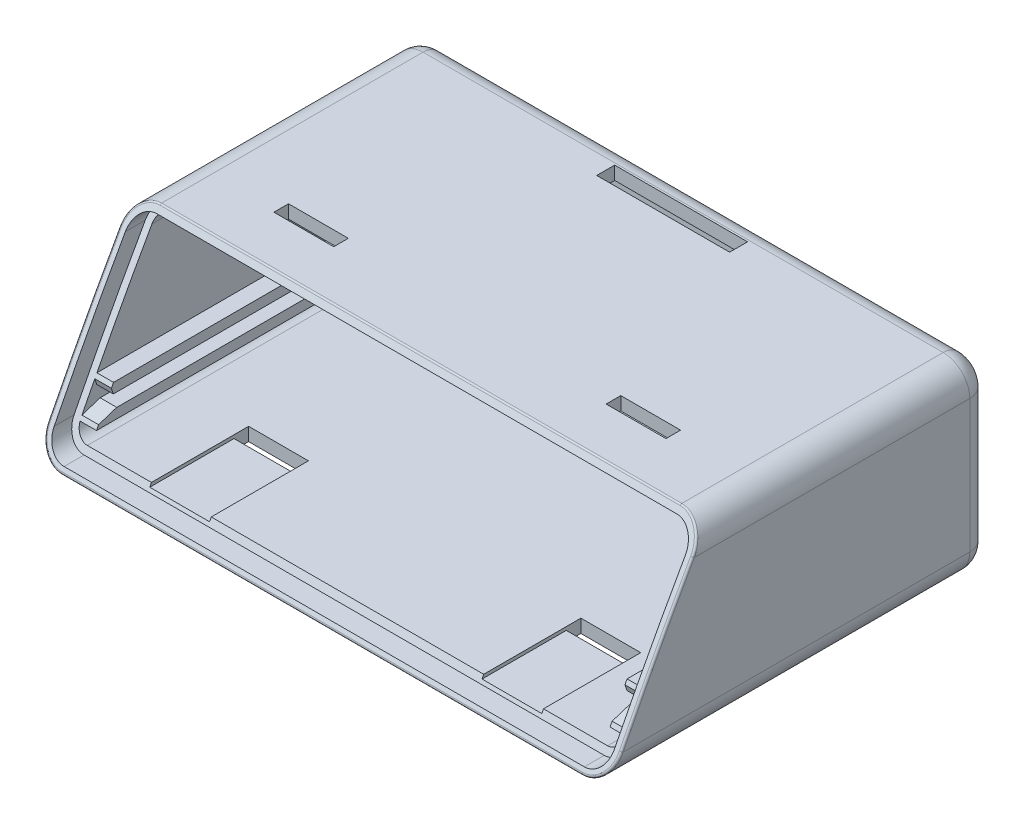
from build123d import *

# Parameters (mm, degrees)
SKETCH1_W                = 86.28
SKETCH1_H                = 57.5
BOSS_EXTRUDE1_DEPTH      = 28
FILLET1_R                = 4
SHELL1_T                 = -2
CUT_EXTRUDE1_DEPTH       = 96.156717577
SKETCH3_W                = 14.3
SKETCH3_H                = 16.7
SKETCH3_W_2              = 11.05
SKETCH3_H_2              = 14.049996967
CUT_EXTRUDE2_DEPTH       = 2
FILLET2_R                = 3
CUT_EXTRUDE3_REACH       = 157.666
CUT_EXTRUDE3_END_RADIUS  = 475
CUT_EXTRUDE3_START       = 80
FILLET3_R                = 0.3
BOSS_EXTRUDE2_REACH      = 77.532
BOSS_EXTRUDE2_END_RADIUS = 475
SKETCH5_W                = 2.5
SKETCH5_H                = 1.5
SKETCH6_W                = 9
SKETCH6_H                = 2.2
CUT_EXTRUDE4_DEPTH       = 2
SKETCH9_W                = 9
SKETCH9_H                = 2.2
CUT_EXTRUDE7_DEPTH       = 2
SKETCH7_W                = 20
SKETCH7_H                = 2.4
CUT_EXTRUDE5_DEPTH       = 2
SKETCH8_W                = 9
SKETCH8_H                = 0.5
CUT_EXTRUDE6_DEPTH       = 63.254847315
SKETCH10_W               = 9
SKETCH10_H               = 0.5
CUT_EXTRUDE8_DEPTH       = 66.822686167
SKETCH11_W               = 2.84
SKETCH11_H               = 2
SKETCH11_W_2             = 33.99
SKETCH11_W_3             = 20.1
BOSS_EXTRUDE3_DEPTH      = 0.5
CHAMFER1_SIZE2           = 2.284662113
CHAMFER1_SIZE            = 1
CHAMFER1_EDGE_2_SIZE2    = 0.742484525
CHAMFER1_EDGE_2_SIZE     = 1
CHAMFER1_EDGE_3_SIZE2    = 0.742484525
CHAMFER1_EDGE_3_SIZE     = 1
CHAMFER1_EDGE_4_SIZE2    = 2.284662113
CHAMFER1_EDGE_4_SIZE     = 1
SKETCH12_W               = 20
SKETCH12_H               = 2
CUT_EXTRUDE9_DEPTH       = 0.3


with BuildPart() as part:
    # Sketch1 → Boss-Extrude1 (new body)
    with BuildSketch(Plane(origin=(0, 0, 0), x_dir=(1, 0, 0), z_dir=(0, 1, 0))):
        Rectangle(SKETCH1_W, SKETCH1_H)
    extrude(amount=BOSS_EXTRUDE1_DEPTH)

    # Fillet1
    fillet1_edges = [part.edges().sort_by_distance(p)[0] for p in [
        (-43.14, 28, 0),
        (43.14, 28, 0),
        (-43.14, 0, 0),
        (43.14, 0, 0),
    ]]
    fillet(fillet1_edges, radius=FILLET1_R)

    # Shell1
    shell1_openings = [part.faces().sort_by_distance(p)[0] for p in [
        (0, 14, 28.75),
    ]]
    offset(amount=SHELL1_T, openings=shell1_openings, kind=Kind.INTERSECTION)

    # Sketch2 → Cut-Extrude1 (cut, through all)
    with BuildSketch(Plane.ZY.offset(43.14)):
        with BuildLine():
            Line((13.75, 28), (28.75, 28))
            Line((28.75, 28), (28.75, 0))
            ThreePointArc((28.75, 0), (21.484121584, 14.125422277), (13.75, 28))
        make_face()
    extrude(amount=-CUT_EXTRUDE1_DEPTH, mode=Mode.SUBTRACT)

    # Sketch3 → Cut-Extrude2 (cut)
    with BuildSketch(Plane(origin=(0, 0, -28.75), x_dir=(-1, 0, 0), z_dir=(0, 0, -1))):
        with Locations((0, 10.35)):
            Rectangle(SKETCH3_W, SKETCH3_H)
        with Locations((32.775, 10.175001517)):
            Rectangle(SKETCH3_W_2, SKETCH3_H_2)
    extrude(amount=-CUT_EXTRUDE2_DEPTH, mode=Mode.SUBTRACT)

    # Fillet2
    # the kernel refuses this fillet: 3 mm, written as the material it takes off along each edge
    with BuildSketch(Plane(origin=(39.14, 24, -28.75), x_dir=(1, 0, 0), z_dir=(0, -1, 0))) as fillet2_piece_1:
        with BuildLine():
            CenterArc((4 - FILLET2_R, FILLET2_R), FILLET2_R, 270, 90)
            Line((4, FILLET2_R), (4, 0))
            Line((4, 0), (4 - FILLET2_R, 0))
        make_face()
    revolve(axis=Axis((39.14, 24, -28.75), (0, 0, 1)), revolution_arc=90, mode=Mode.SUBTRACT)
    with BuildSketch(Plane(origin=(43.14, 4, -28.75), x_dir=(-1, 0, 0), z_dir=(0, 1, 0)), Plane(origin=(-43.14, 4, -28.75), x_dir=(0, 0, 1), z_dir=(0, 1, 0))) as fillet2_piece_2:
        with BuildLine():
            CenterArc((FILLET2_R, FILLET2_R), FILLET2_R, 180, 90)
            Line((0, FILLET2_R), (0, 0))
            Line((0, 0), (FILLET2_R, 0))
        make_face()
    extrude(amount=20, mode=Mode.SUBTRACT)
    with BuildSketch(Plane(origin=(39.14, 4, -28.75), x_dir=(1, 0, 0), z_dir=(0, 1, 0))) as fillet2_piece_3:
        with BuildLine():
            CenterArc((4 - FILLET2_R, -FILLET2_R), FILLET2_R, 0, 90)
            Line((4, -FILLET2_R), (4, 0))
            Line((4, 0), (4 - FILLET2_R, 0))
        make_face()
    revolve(axis=Axis((39.14, 4, -28.75), (0, 0, -1)), revolution_arc=90, mode=Mode.SUBTRACT)
    with BuildSketch(Plane(origin=(39.14, 0, -28.75), x_dir=(0, 1, 0), z_dir=(-1, 0, 0))) as fillet2_piece_4:
        with BuildLine():
            CenterArc((FILLET2_R, -FILLET2_R), FILLET2_R, 90, 90)
            Line((0, -FILLET2_R), (0, 0))
            Line((0, 0), (FILLET2_R, 0))
        make_face()
    extrude(amount=78.28, mode=Mode.SUBTRACT)
    with BuildSketch(Plane(origin=(-39.14, 4, -28.75), x_dir=(-1, 0, 0), z_dir=(0, 1, 0))) as fillet2_piece_5:
        with BuildLine():
            CenterArc((4 - FILLET2_R, FILLET2_R), FILLET2_R, 270, 90)
            Line((4 - FILLET2_R, 0), (4, 0))
            Line((4, 0), (4, FILLET2_R))
        make_face()
    revolve(axis=Axis((-39.14, 4, -28.75), (0, 0, 1)), revolution_arc=90, mode=Mode.SUBTRACT)
    with BuildSketch(Plane(origin=(-39.14, 24, -28.75), x_dir=(-1, 0, 0), z_dir=(0, -1, 0))) as fillet2_piece_6:
        with BuildLine():
            CenterArc((4 - FILLET2_R, -FILLET2_R), FILLET2_R, 0, 90)
            Line((4 - FILLET2_R, 0), (4, 0))
            Line((4, 0), (4, -FILLET2_R))
        make_face()
    revolve(axis=Axis((-39.14, 24, -28.75), (0, 0, -1)), revolution_arc=90, mode=Mode.SUBTRACT)
    with BuildSketch(Plane(origin=(39.14, 28, -28.75), x_dir=(0, -1, 0), z_dir=(-1, 0, 0))) as fillet2_piece_7:
        with BuildLine():
            CenterArc((FILLET2_R, FILLET2_R), FILLET2_R, 180, 90)
            Line((0, FILLET2_R), (0, 0))
            Line((0, 0), (FILLET2_R, 0))
        make_face()
    extrude(amount=78.28, mode=Mode.SUBTRACT)

    # Cut-Extrude3: up to this cylinder (the profile starts outside it)
    cut_extrude3_end = Plane(origin=(-23.145, -210.179748667, -400.218864179), z_dir=(-1, 0, 0)) * Cylinder(CUT_EXTRUDE3_END_RADIUS, 1266.332, mode=Mode.PRIVATE)
    # Sketch4 → Cut-Extrude3 (cut, up to the surface)
    with BuildSketch(Plane.XY.offset(-26.75).offset(CUT_EXTRUDE3_START), mode=Mode.PRIVATE) as cut_extrude3_sk1:
        with BuildLine():
            Line((-7.15, 1), (7.15, 1))
            Line((7.15, 1), (39.14, 1))
            ThreePointArc((39.14, 1), (41.261320344, 1.878679656), (42.14, 4))
            Line((42.14, 4), (42.14, 24))
            ThreePointArc((42.14, 24), (41.261320344, 26.121320344), (39.14, 27))
            Line((39.14, 27), (-39.14, 27))
            ThreePointArc((-39.14, 27), (-41.261320344, 26.121320344), (-42.14, 24))
            Line((-42.14, 24), (-42.14, 4))
            ThreePointArc((-42.14, 4), (-41.261320344, 1.878679656), (-39.14, 1))
            Line((-39.14, 1), (-7.15, 1))
        make_face()
        with BuildLine():
            Line((-7.15, 2), (7.15, 2))
            Line((7.15, 2), (39.14, 2))
            ThreePointArc((39.14, 2), (40.554213562, 2.585786438), (41.14, 4))
            Line((41.14, 4), (41.14, 24))
            ThreePointArc((41.14, 24), (40.554213562, 25.414213562), (39.14, 26))
            Line((39.14, 26), (-39.14, 26))
            ThreePointArc((-39.14, 26), (-40.554213562, 25.414213562), (-41.14, 24))
            Line((-41.14, 24), (-41.14, 4))
            ThreePointArc((-41.14, 4), (-40.554213562, 2.585786438), (-39.14, 2))
            Line((-39.14, 2), (-7.15, 2))
        make_face(mode=Mode.SUBTRACT)
    cut_extrude3_tool1 = extrude(cut_extrude3_sk1.sketch, amount=-CUT_EXTRUDE3_REACH, mode=Mode.PRIVATE) - cut_extrude3_end
    add(cut_extrude3_tool1.solids().sort_by_distance((-23.145, 1.881993, 53.25))[0], mode=Mode.SUBTRACT)

    # Fillet3
    fillet3_edges = [part.edges().sort_by_distance(p)[0] for p in [
        (0, 0, 28.75),
        (-43.14, 14.0639546, 21.517044891),
        (42.064985447, 26.728453829, 14.484309952),
        (42.046759265, 1.252137055, 28.129884144),
        (-42.046759265, 1.252137055, 28.129884144),
        (-42.064985447, 26.728453829, 14.484309952),
        (43.14, 14.0639546, 21.517044891),
        (0, 28, 13.75),
    ]]
    fillet(fillet3_edges, radius=FILLET3_R)

    # Boss-Extrude2: up to this cylinder (the profile starts inside it)
    boss_extrude2_end = Plane(origin=(0, -210.179748667, -400.218864179), z_dir=(-1, 0, 0)) * Cylinder(BOSS_EXTRUDE2_END_RADIUS, 1185.844, mode=Mode.PRIVATE)
    # Sketch5 → Boss-Extrude2 (add, up to the surface)
    with BuildSketch(Plane.XY.offset(-26.75), mode=Mode.PRIVATE) as boss_extrude2_sk1:
        with Locations((39.89, 4.5)):
            Rectangle(SKETCH5_W, SKETCH5_H)
    boss_extrude2_tool1 = extrude(boss_extrude2_sk1.sketch, amount=BOSS_EXTRUDE2_REACH, mode=Mode.PRIVATE) & boss_extrude2_end
    add(boss_extrude2_tool1.solids().sort_by_distance((39.89, 4.5, -26.75))[0])
    # Sketch5 → Boss-Extrude2 (add, up to the surface)
    with BuildSketch(Plane.XY.offset(-26.75), mode=Mode.PRIVATE) as boss_extrude2_sk2:
        with Locations((39.89, 8)):
            Rectangle(SKETCH5_W, SKETCH5_H)
    boss_extrude2_tool2 = extrude(boss_extrude2_sk2.sketch, amount=BOSS_EXTRUDE2_REACH, mode=Mode.PRIVATE) & boss_extrude2_end
    add(boss_extrude2_tool2.solids().sort_by_distance((39.89, 8, -26.75))[0])
    # Sketch5 → Boss-Extrude2 (add, up to the surface)
    with BuildSketch(Plane.XY.offset(-26.75), mode=Mode.PRIVATE) as boss_extrude2_sk3:
        with Locations((-39.89, 8)):
            Rectangle(SKETCH5_W, SKETCH5_H)
    boss_extrude2_tool3 = extrude(boss_extrude2_sk3.sketch, amount=BOSS_EXTRUDE2_REACH, mode=Mode.PRIVATE) & boss_extrude2_end
    add(boss_extrude2_tool3.solids().sort_by_distance((-39.89, 8, -26.75))[0])
    # Sketch5 → Boss-Extrude2 (add, up to the surface)
    with BuildSketch(Plane.XY.offset(-26.75), mode=Mode.PRIVATE) as boss_extrude2_sk4:
        with Locations((-39.89, 4.5)):
            Rectangle(SKETCH5_W, SKETCH5_H)
    boss_extrude2_tool4 = extrude(boss_extrude2_sk4.sketch, amount=BOSS_EXTRUDE2_REACH, mode=Mode.PRIVATE) & boss_extrude2_end
    add(boss_extrude2_tool4.solids().sort_by_distance((-39.89, 4.5, -26.75))[0])

    # Sketch6 → Cut-Extrude4 (cut)
    with BuildSketch(Plane(origin=(0, 28, 0), x_dir=(1, 0, 0), z_dir=(0, 1, 0))):
        with Locations((25, -5.23)):
            Rectangle(SKETCH6_W, SKETCH6_H)
        with Locations((-25, -5.23)):
            Rectangle(SKETCH6_W, SKETCH6_H)
    extrude(amount=-CUT_EXTRUDE4_DEPTH, mode=Mode.SUBTRACT)

    # Sketch9 → Cut-Extrude7 (cut)
    with BuildSketch(Plane.XZ):
        with Locations((-25, 11.23)):
            Rectangle(SKETCH9_W, SKETCH9_H)
        with Locations((25, 11.23)):
            Rectangle(SKETCH9_W, SKETCH9_H)
    extrude(amount=-CUT_EXTRUDE7_DEPTH, mode=Mode.SUBTRACT)

    # Sketch7 → Cut-Extrude5 (cut)
    with BuildSketch(Plane(origin=(0, 28, 0), x_dir=(1, 0, 0), z_dir=(0, 1, 0))):
        with Locations((0, 23.95)):
            Rectangle(SKETCH7_W, SKETCH7_H)
    extrude(amount=-CUT_EXTRUDE5_DEPTH, mode=Mode.SUBTRACT)

    # Sketch8 → Cut-Extrude6 (cut, through all)
    with BuildSketch(Plane(origin=(0, 0, 6.33), x_dir=(-1, 0, 0), z_dir=(0, 0, -1))):
        with Locations((25, 26.25)):
            Rectangle(SKETCH8_W, SKETCH8_H)
        with Locations((-25, 26.25)):
            Rectangle(SKETCH8_W, SKETCH8_H)
    extrude(amount=-CUT_EXTRUDE6_DEPTH, mode=Mode.SUBTRACT)

    # Sketch10 → Cut-Extrude8 (cut, through all)
    with BuildSketch(Plane(origin=(0, 0, 12.33), x_dir=(-1, 0, 0), z_dir=(0, 0, -1))):
        with Locations((25, 1.75)):
            Rectangle(SKETCH10_W, SKETCH10_H)
        with Locations((-25, 1.75)):
            Rectangle(SKETCH10_W, SKETCH10_H)
    extrude(amount=-CUT_EXTRUDE8_DEPTH, mode=Mode.SUBTRACT)

    # Sketch11 → Boss-Extrude3 (add)
    with BuildSketch(Plane.XY.offset(-26.75)):
        with Locations((-39.72, 6.25)):
            Rectangle(SKETCH11_W, SKETCH11_H)
        with Locations((24.145, 6.25)):
            Rectangle(SKETCH11_W_2, SKETCH11_H)
        with Locations((-17.2, 6.25)):
            Rectangle(SKETCH11_W_3, SKETCH11_H)
    extrude(amount=BOSS_EXTRUDE3_DEPTH)

    # Chamfer1
    chamfer1_edges = [part.edges().sort_by_distance(p)[0] for p in [
        (39.89, 5.25, 23.11908993),
    ]]
    chamfer(chamfer1_edges, length=CHAMFER1_SIZE, length2=CHAMFER1_SIZE2)

    # Chamfer1 edge 2
    chamfer1_edge_2_edges = [part.edges().sort_by_distance(p)[0] for p in [
        (39.89, 7.25, 22.095360533),
    ]]
    chamfer(chamfer1_edge_2_edges, length=CHAMFER1_EDGE_2_SIZE, length2=CHAMFER1_EDGE_2_SIZE2)

    # Chamfer1 edge 3
    chamfer1_edge_3_edges = [part.edges().sort_by_distance(p)[0] for p in [
        (-39.89, 7.25, 22.095360533),
    ]]
    chamfer(chamfer1_edge_3_edges, length=CHAMFER1_EDGE_3_SIZE, length2=CHAMFER1_EDGE_3_SIZE2)

    # Chamfer1 edge 4
    chamfer1_edge_4_edges = [part.edges().sort_by_distance(p)[0] for p in [
        (-39.89, 5.25, 23.11908993),
    ]]
    chamfer(chamfer1_edge_4_edges, length=CHAMFER1_EDGE_4_SIZE, length2=CHAMFER1_EDGE_4_SIZE2)

    # Sketch12 → Cut-Extrude9 (cut)
    with BuildSketch(Plane.XY.offset(-25.15)):
        with Locations((0, 27)):
            Rectangle(SKETCH12_W, SKETCH12_H)
    extrude(amount=-CUT_EXTRUDE9_DEPTH, mode=Mode.SUBTRACT)


solid = part.part
